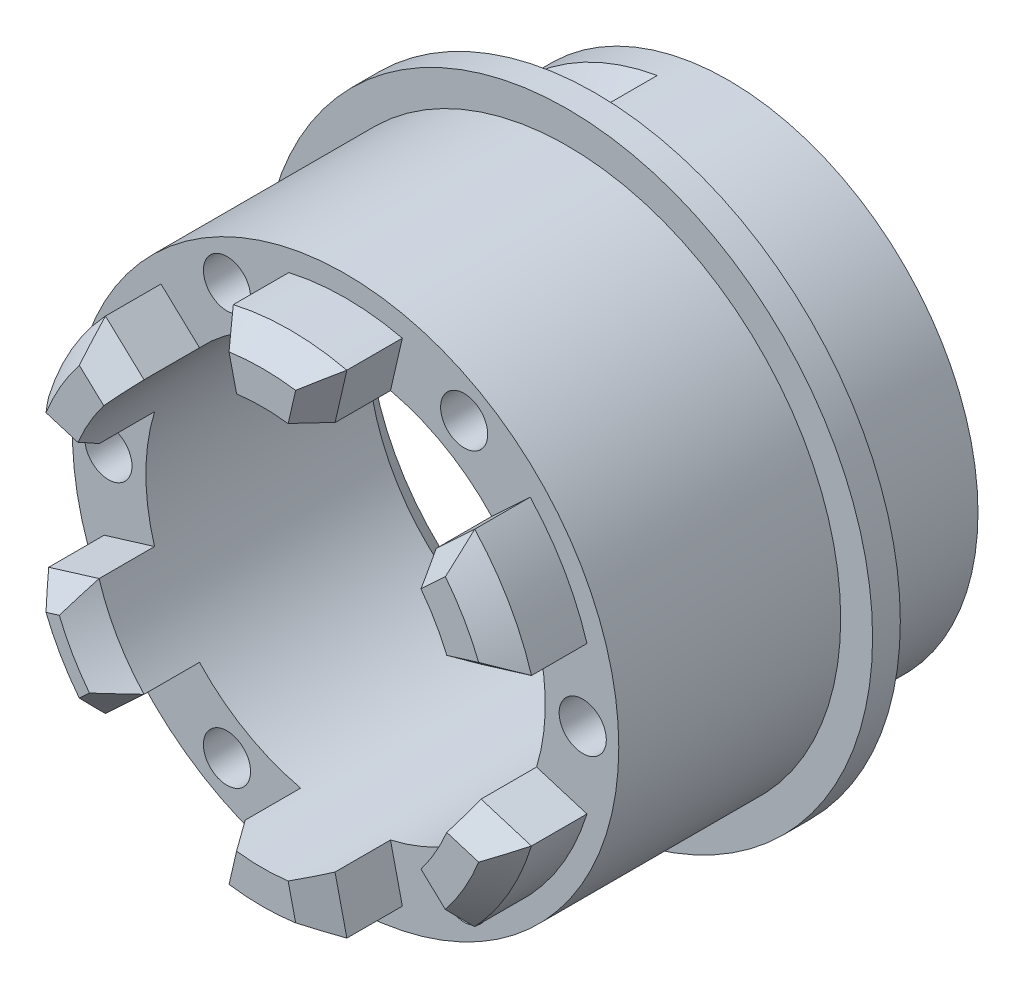
from build123d import *
from OCP.BRepFilletAPI import BRepFilletAPI_MakeChamfer
from build123d.topology import SkipClean

# Parameters (mm, degrees)
SKETCH_1_R          = 9
EXTRUDE_1_DEPTH     = 2
SKETCH_2_R          = 9
SKETCH_2_R_2        = 7.2
EXTRUDE_2_DEPTH     = 2.8
SKETCH_4_R          = 11
SKETCH_4_R_2        = 7.2
EXTRUDE_3_DEPTH     = 1
SKETCH_5_R          = 9.85
SKETCH_5_R_2        = 7.2
EXTRUDE_4_DEPTH     = 8
SKETCH_6_R          = 0.85
CUT_EXTRUDE_1_DEPTH = 8
SKETCH_7_R          = 3
SKETCH_7_R_2        = 1.1
CUT_EXTRUDE_2_DEPTH = 21.795191752
EXTRUDE_5_DEPTH     = 3
CHAMFER_1_SIZE      = 1
CHAMFER_1_SIZE2     = 0.700207538
CUT_EXTRUDE_START   = -2
SKETCH_11_R         = 1.1
CUT_EXTRUDE_3_DEPTH = 2.8
CHAMFER_2_SIZE      = 1


with BuildPart() as part:
    # 스케치1 → 보스-돌출1 (new body)
    with BuildSketch(Plane.XY):
        Circle(SKETCH_1_R)
    extrude(amount=EXTRUDE_1_DEPTH)

    # 스케치2 → 보스-돌출2 (add)
    with BuildSketch(Plane.XY.offset(2)):
        Circle(SKETCH_2_R)
        Circle(SKETCH_2_R_2, mode=Mode.SUBTRACT)
    extrude(amount=EXTRUDE_2_DEPTH)

    # 스케치4 → 보스-돌출3 (add)
    with BuildSketch(Plane.XY.offset(4.8)):
        Circle(SKETCH_4_R)
        Circle(SKETCH_4_R_2, mode=Mode.SUBTRACT)
    extrude(amount=EXTRUDE_3_DEPTH)

    # 스케치5 → 보스-돌출4 (add)
    with BuildSketch(Plane.XY.offset(5.8)):
        Circle(SKETCH_5_R)
        Circle(SKETCH_5_R_2, mode=Mode.SUBTRACT)
    extrude(amount=EXTRUDE_4_DEPTH)

    # 스케치6 → 컷-돌출1 (cut)
    with BuildSketch(Plane.XY.offset(13.8)):
        with Locations((8.55, 0)):
            Circle(SKETCH_6_R)
        with Locations((4.275, -7.404517202)):
            Circle(SKETCH_6_R)
        with Locations((-4.275, -7.404517202)):
            Circle(SKETCH_6_R)
        with Locations((-8.55, 0)):
            Circle(SKETCH_6_R)
        with Locations((-4.275, 7.404517202)):
            Circle(SKETCH_6_R)
        with Locations((4.275, 7.404517202)):
            Circle(SKETCH_6_R)
    extrude(amount=-CUT_EXTRUDE_1_DEPTH, mode=Mode.SUBTRACT)

    # 스케치7 → 컷-돌출2 (cut, through all)
    with BuildSketch(Plane(origin=(0, 0, 0), x_dir=(-1, 0, 0), z_dir=(0, 0, -1))):
        Circle(SKETCH_7_R)
        with Locations((-6, 0)):
            Circle(SKETCH_7_R_2)
        with Locations((6, 0)):
            Circle(SKETCH_7_R_2)
        with Locations((0, 6)):
            Circle(SKETCH_7_R_2)
        with Locations((0, -6)):
            Circle(SKETCH_7_R_2)
    extrude(amount=-CUT_EXTRUDE_2_DEPTH, mode=Mode.SUBTRACT)

    # 스케치10 → 보스-돌출5 (add)
    with SkipClean():  # the faces are left unmerged after this step: merging them gives an invalid solid
        with BuildSketch(Plane.XY.offset(13.8)):
            with BuildLine():
                Line((2.047054595, 8.86676759), (1.619647591, 7.015464466))
                ThreePointArc((1.619647591, 7.015464466), (0, 7.2), (-1.619647591, 7.015464466))
                Line((-1.619647591, 7.015464466), (-2.047054595, 8.86676759))
                ThreePointArc((-2.047054595, 8.86676759), (0, 9.1), (2.047054595, 8.86676759))
            make_face()
            with BuildLine():
                Line((6.655318685, 6.206185077), (5.265746652, 4.910388192))
                ThreePointArc((5.265746652, 4.910388192), (6.235382907, 3.6), (6.885394243, 2.105076274))
                Line((6.885394243, 2.105076274), (8.702373279, 2.660582513))
                ThreePointArc((8.702373279, 2.660582513), (7.880831174, 4.55), (6.655318685, 6.206185077))
            make_face()
            with BuildLine():
                Line((8.702373279, -2.660582513), (6.885394243, -2.105076274))
                ThreePointArc((6.885394243, -2.105076274), (6.235382907, -3.6), (5.265746652, -4.910388192))
                Line((5.265746652, -4.910388192), (6.655318685, -6.206185077))
                ThreePointArc((6.655318685, -6.206185077), (7.880831174, -4.55), (8.702373279, -2.660582513))
            make_face()
            with BuildLine():
                Line((2.047054595, -8.86676759), (1.619647591, -7.015464466))
                ThreePointArc((1.619647591, -7.015464466), (0, -7.2), (-1.619647591, -7.015464466))
                Line((-1.619647591, -7.015464466), (-2.047054595, -8.86676759))
                ThreePointArc((-2.047054595, -8.86676759), (0, -9.1), (2.047054595, -8.86676759))
            make_face()
            with BuildLine():
                Line((-6.655318685, -6.206185077), (-5.265746652, -4.910388192))
                ThreePointArc((-5.265746652, -4.910388192), (-6.235382907, -3.6), (-6.885394243, -2.105076274))
                Line((-6.885394243, -2.105076274), (-8.702373279, -2.660582513))
                ThreePointArc((-8.702373279, -2.660582513), (-7.880831174, -4.55), (-6.655318685, -6.206185077))
            make_face()
            with BuildLine():
                Line((-8.702373279, 2.660582513), (-6.885394243, 2.105076274))
                ThreePointArc((-6.885394243, 2.105076274), (-6.235382907, 3.6), (-5.265746652, 4.910388192))
                Line((-5.265746652, 4.910388192), (-6.655318685, 6.206185077))
                ThreePointArc((-6.655318685, 6.206185077), (-7.880831174, 4.55), (-8.702373279, 2.660582513))
            make_face()
        extrude(amount=EXTRUDE_5_DEPTH)

    # 모따기1: one chamfer whose edges measure the first distance from different faces: ONE call of the kernel's chamfer builder (chamfer() names one face for all edges)
    chamfer_1_edges_1 = [part.edges().sort_by_distance(p)[0] for p in [
        (-7.880831174, -4.55, 16.8),
    ]]
    chamfer_1_side_1 = [part.faces().sort_by_distance(p)[0] for p in [
        (-7.880831174, -4.55, 15.3),
    ]]
    chamfer_1_edges_2 = [part.edges().sort_by_distance(p)[0] for p in [
        (0, -9.1, 16.8),
    ]]
    chamfer_1_side_2 = [part.faces().sort_by_distance(p)[0] for p in [
        (0, -9.1, 15.3),
    ]]
    chamfer_1_edges_3 = [part.edges().sort_by_distance(p)[0] for p in [
        (7.880831174, -4.55, 16.8),
    ]]
    chamfer_1_side_3 = [part.faces().sort_by_distance(p)[0] for p in [
        (7.880831174, -4.55, 15.3),
    ]]
    chamfer_1_edges_4 = [part.edges().sort_by_distance(p)[0] for p in [
        (7.880831174, 4.55, 16.8),
    ]]
    chamfer_1_side_4 = [part.faces().sort_by_distance(p)[0] for p in [
        (7.880831174, 4.55, 15.3),
    ]]
    chamfer_1_edges_5 = [part.edges().sort_by_distance(p)[0] for p in [
        (0, 9.1, 16.8),
    ]]
    chamfer_1_side_5 = [part.faces().sort_by_distance(p)[0] for p in [
        (0, 9.1, 15.3),
    ]]
    chamfer_1_edges_6 = [part.edges().sort_by_distance(p)[0] for p in [
        (-7.880831174, 4.55, 16.8),
    ]]
    chamfer_1_side_6 = [part.faces().sort_by_distance(p)[0] for p in [
        (-7.880831174, 4.55, 15.3),
    ]]
    chamfer_1_edges_7 = [part.edges().sort_by_distance(p)[0] for p in [
        (-7.793883761, -2.382829393, 16.8),
    ]]
    chamfer_1_side_7 = [part.faces().sort_by_distance(p)[0] for p in [
        (-7.793883761, -2.382829393, 15.3),
    ]]
    chamfer_1_edges_8 = [part.edges().sort_by_distance(p)[0] for p in [
        (-6.235382907, -3.6, 16.8),
    ]]
    chamfer_1_side_8 = [part.faces().sort_by_distance(p)[0] for p in [
        (-6.235382907, -3.6, 15.3),
    ]]
    chamfer_1_edges_9 = [part.edges().sort_by_distance(p)[0] for p in [
        (-5.960532668, -5.558286635, 16.8),
    ]]
    chamfer_1_side_9 = [part.faces().sort_by_distance(p)[0] for p in [
        (-5.960532668, -5.558286635, 15.3),
    ]]
    chamfer_1_edges_10 = [part.edges().sort_by_distance(p)[0] for p in [
        (1.833351093, -7.941116028, 16.8),
    ]]
    chamfer_1_side_10 = [part.faces().sort_by_distance(p)[0] for p in [
        (1.833351093, -7.941116028, 15.3),
    ]]
    chamfer_1_edges_11 = [part.edges().sort_by_distance(p)[0] for p in [
        (-1.833351093, -7.941116028, 16.8),
    ]]
    chamfer_1_side_11 = [part.faces().sort_by_distance(p)[0] for p in [
        (-1.833351093, -7.941116028, 15.3),
    ]]
    chamfer_1_edges_12 = [part.edges().sort_by_distance(p)[0] for p in [
        (5.960532668, -5.558286635, 16.8),
    ]]
    chamfer_1_side_12 = [part.faces().sort_by_distance(p)[0] for p in [
        (5.960532668, -5.558286635, 15.3),
    ]]
    chamfer_1_edges_13 = [part.edges().sort_by_distance(p)[0] for p in [
        (7.793883761, -2.382829393, 16.8),
    ]]
    chamfer_1_side_13 = [part.faces().sort_by_distance(p)[0] for p in [
        (7.793883761, -2.382829393, 15.3),
    ]]
    chamfer_1_edges_14 = [part.edges().sort_by_distance(p)[0] for p in [
        (7.793883761, 2.382829393, 16.8),
    ]]
    chamfer_1_side_14 = [part.faces().sort_by_distance(p)[0] for p in [
        (7.793883761, 2.382829393, 15.3),
    ]]
    chamfer_1_edges_15 = [part.edges().sort_by_distance(p)[0] for p in [
        (5.960532668, 5.558286635, 16.8),
    ]]
    chamfer_1_side_15 = [part.faces().sort_by_distance(p)[0] for p in [
        (5.960532668, 5.558286635, 15.3),
    ]]
    chamfer_1_edges_16 = [part.edges().sort_by_distance(p)[0] for p in [
        (1.833351093, 7.941116028, 16.8),
    ]]
    chamfer_1_side_16 = [part.faces().sort_by_distance(p)[0] for p in [
        (1.833351093, 7.941116028, 15.3),
    ]]
    chamfer_1_edges_17 = [part.edges().sort_by_distance(p)[0] for p in [
        (-1.833351093, 7.941116028, 16.8),
    ]]
    chamfer_1_side_17 = [part.faces().sort_by_distance(p)[0] for p in [
        (-1.833351093, 7.941116028, 15.3),
    ]]
    chamfer_1_edges_18 = [part.edges().sort_by_distance(p)[0] for p in [
        (-7.793883761, 2.382829393, 16.8),
    ]]
    chamfer_1_side_18 = [part.faces().sort_by_distance(p)[0] for p in [
        (-7.793883761, 2.382829393, 15.3),
    ]]
    chamfer_1_edges_19 = [part.edges().sort_by_distance(p)[0] for p in [
        (-5.960532668, 5.558286635, 16.8),
    ]]
    chamfer_1_side_19 = [part.faces().sort_by_distance(p)[0] for p in [
        (-5.960532668, 5.558286635, 15.3),
    ]]
    chamfer_1 = BRepFilletAPI_MakeChamfer(part.part.solid().wrapped)
    for e in chamfer_1_edges_1:
        chamfer_1.Add(CHAMFER_1_SIZE, CHAMFER_1_SIZE2, e.wrapped, chamfer_1_side_1[0].wrapped)  # the first distance lies on this face
    for e in chamfer_1_edges_2:
        chamfer_1.Add(CHAMFER_1_SIZE, CHAMFER_1_SIZE2, e.wrapped, chamfer_1_side_2[0].wrapped)  # the first distance lies on this face
    for e in chamfer_1_edges_3:
        chamfer_1.Add(CHAMFER_1_SIZE, CHAMFER_1_SIZE2, e.wrapped, chamfer_1_side_3[0].wrapped)  # the first distance lies on this face
    for e in chamfer_1_edges_4:
        chamfer_1.Add(CHAMFER_1_SIZE, CHAMFER_1_SIZE2, e.wrapped, chamfer_1_side_4[0].wrapped)  # the first distance lies on this face
    for e in chamfer_1_edges_5:
        chamfer_1.Add(CHAMFER_1_SIZE, CHAMFER_1_SIZE2, e.wrapped, chamfer_1_side_5[0].wrapped)  # the first distance lies on this face
    for e in chamfer_1_edges_6:
        chamfer_1.Add(CHAMFER_1_SIZE, CHAMFER_1_SIZE2, e.wrapped, chamfer_1_side_6[0].wrapped)  # the first distance lies on this face
    for e in chamfer_1_edges_7:
        chamfer_1.Add(CHAMFER_1_SIZE, CHAMFER_1_SIZE2, e.wrapped, chamfer_1_side_7[0].wrapped)  # the first distance lies on this face
    for e in chamfer_1_edges_8:
        chamfer_1.Add(CHAMFER_1_SIZE, CHAMFER_1_SIZE2, e.wrapped, chamfer_1_side_8[0].wrapped)  # the first distance lies on this face
    for e in chamfer_1_edges_9:
        chamfer_1.Add(CHAMFER_1_SIZE, CHAMFER_1_SIZE2, e.wrapped, chamfer_1_side_9[0].wrapped)  # the first distance lies on this face
    for e in chamfer_1_edges_10:
        chamfer_1.Add(CHAMFER_1_SIZE, CHAMFER_1_SIZE2, e.wrapped, chamfer_1_side_10[0].wrapped)  # the first distance lies on this face
    for e in chamfer_1_edges_11:
        chamfer_1.Add(CHAMFER_1_SIZE, CHAMFER_1_SIZE2, e.wrapped, chamfer_1_side_11[0].wrapped)  # the first distance lies on this face
    for e in chamfer_1_edges_12:
        chamfer_1.Add(CHAMFER_1_SIZE, CHAMFER_1_SIZE2, e.wrapped, chamfer_1_side_12[0].wrapped)  # the first distance lies on this face
    for e in chamfer_1_edges_13:
        chamfer_1.Add(CHAMFER_1_SIZE, CHAMFER_1_SIZE2, e.wrapped, chamfer_1_side_13[0].wrapped)  # the first distance lies on this face
    for e in chamfer_1_edges_14:
        chamfer_1.Add(CHAMFER_1_SIZE, CHAMFER_1_SIZE2, e.wrapped, chamfer_1_side_14[0].wrapped)  # the first distance lies on this face
    for e in chamfer_1_edges_15:
        chamfer_1.Add(CHAMFER_1_SIZE, CHAMFER_1_SIZE2, e.wrapped, chamfer_1_side_15[0].wrapped)  # the first distance lies on this face
    for e in chamfer_1_edges_16:
        chamfer_1.Add(CHAMFER_1_SIZE, CHAMFER_1_SIZE2, e.wrapped, chamfer_1_side_16[0].wrapped)  # the first distance lies on this face
    for e in chamfer_1_edges_17:
        chamfer_1.Add(CHAMFER_1_SIZE, CHAMFER_1_SIZE2, e.wrapped, chamfer_1_side_17[0].wrapped)  # the first distance lies on this face
    for e in chamfer_1_edges_18:
        chamfer_1.Add(CHAMFER_1_SIZE, CHAMFER_1_SIZE2, e.wrapped, chamfer_1_side_18[0].wrapped)  # the first distance lies on this face
    for e in chamfer_1_edges_19:
        chamfer_1.Add(CHAMFER_1_SIZE, CHAMFER_1_SIZE2, e.wrapped, chamfer_1_side_19[0].wrapped)  # the first distance lies on this face
    add(Compound.cast(chamfer_1.Shape()), mode=Mode.REPLACE)

    # 스케치11 → 컷-돌출3 (cut)
    with BuildSketch(Plane(origin=(0, 0, 0), x_dir=(-1, 0, 0), z_dir=(0, 0, -1)).offset(CUT_EXTRUDE_START)):
        with BuildLine():
            Line((1.562833599, 8.863269777), (0.520944533, 2.954423259))
            ThreePointArc((0.520944533, 2.954423259), (3, 0), (0.520944533, -2.954423259))
            Line((0.520944533, -2.954423259), (1.562833599, -8.863269777))
            ThreePointArc((1.562833599, -8.863269777), (9, 0), (1.562833599, 8.863269777))
        make_face()
        with Locations((6, 0)):
            Circle(SKETCH_11_R, mode=Mode.SUBTRACT)
    extrude(amount=-CUT_EXTRUDE_3_DEPTH, mode=Mode.SUBTRACT)

    # 모따기2
    chamfer_2_edges = [part.edges().sort_by_distance(p)[0] for p in [
        (-7.2, 0, 4.8),
        (-9, 0, 2),
    ]]
    chamfer(chamfer_2_edges, length=CHAMFER_2_SIZE)


solid = part.part
